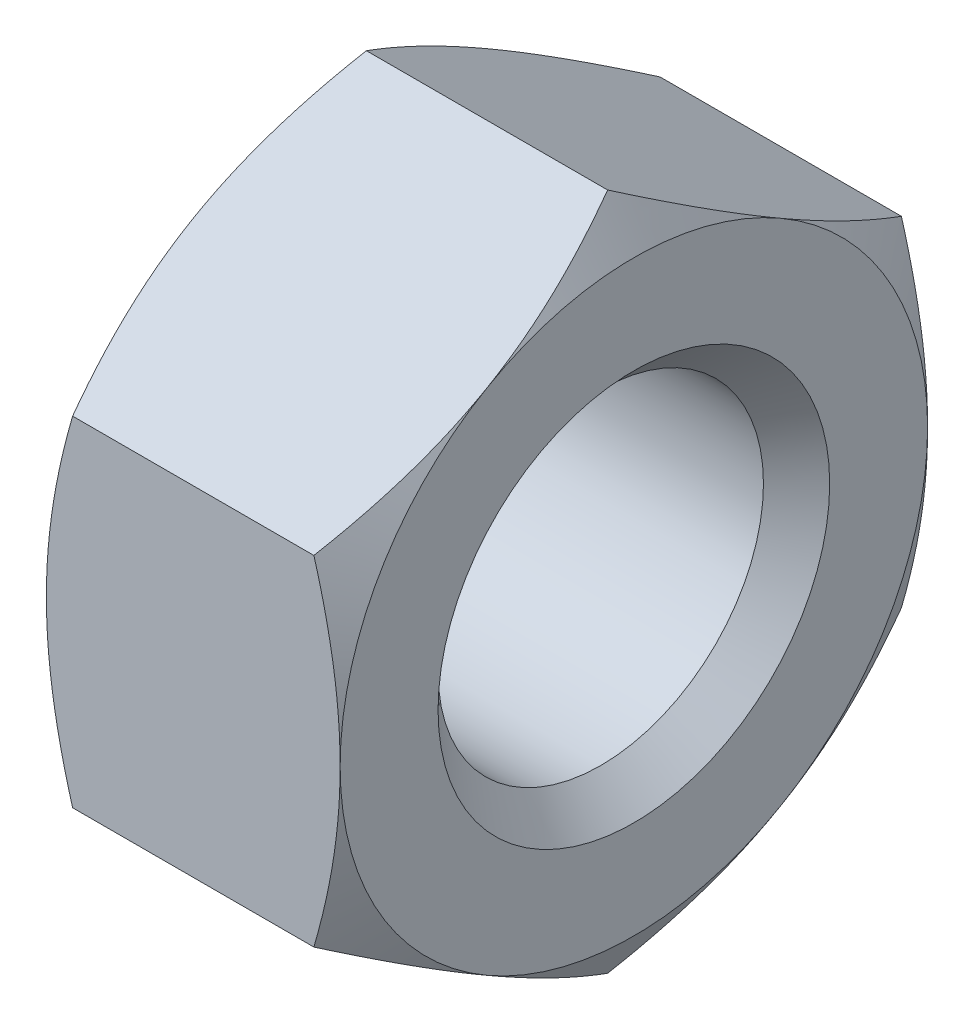
from build123d import *

# Parameters (mm, degrees)
CUT_EXTRUDE_1_DEPTH      = 3
CUT_EXTRUDE_1_DEPTH_BACK = 3
SKETCH_3_W               = 24
SKETCH_3_H               = 24


with BuildPart() as part:
    # 草图1 → 旋转1 (revolve)
    with BuildSketch(Plane.XY):
        Polygon((-3, 0), (-3, 6), (-2.307179677, 7.2), (2.307179677, 7.2), (3, 6), (3, 0), align=None)
    revolve(axis=Axis((3, 0, 0), (-1, 0, 0)))

    # 草图2 → 切除-旋转1 (revolve, cut)
    with BuildSketch(Plane.XY):
        Polygon((-3, 0), (-3, 4), (-2.3235, 3.3235), (2.3235, 3.3235), (3, 4), (3, 0), align=None)
    revolve(axis=Axis((3, 0, 0), (-1, 0, 0)), mode=Mode.SUBTRACT)

    # 草图3 → 切除-拉伸1 (cut, two sides: drawn at the far end of the back side and taken through both)
    with BuildSketch(Plane(origin=(0, 0, 0), x_dir=(0, 0, -1), z_dir=(1, 0, 0)).offset(-CUT_EXTRUDE_1_DEPTH_BACK)):
        Rectangle(SKETCH_3_W, SKETCH_3_H)
        Polygon((-6, -3.464101615), (0, -6.92820323), (6, -3.464101615), (6, 3.464101615), (0, 6.92820323), (-6, 3.464101615), align=None, mode=Mode.SUBTRACT)
    extrude(amount=CUT_EXTRUDE_1_DEPTH + CUT_EXTRUDE_1_DEPTH_BACK, mode=Mode.SUBTRACT)


solid = part.part
